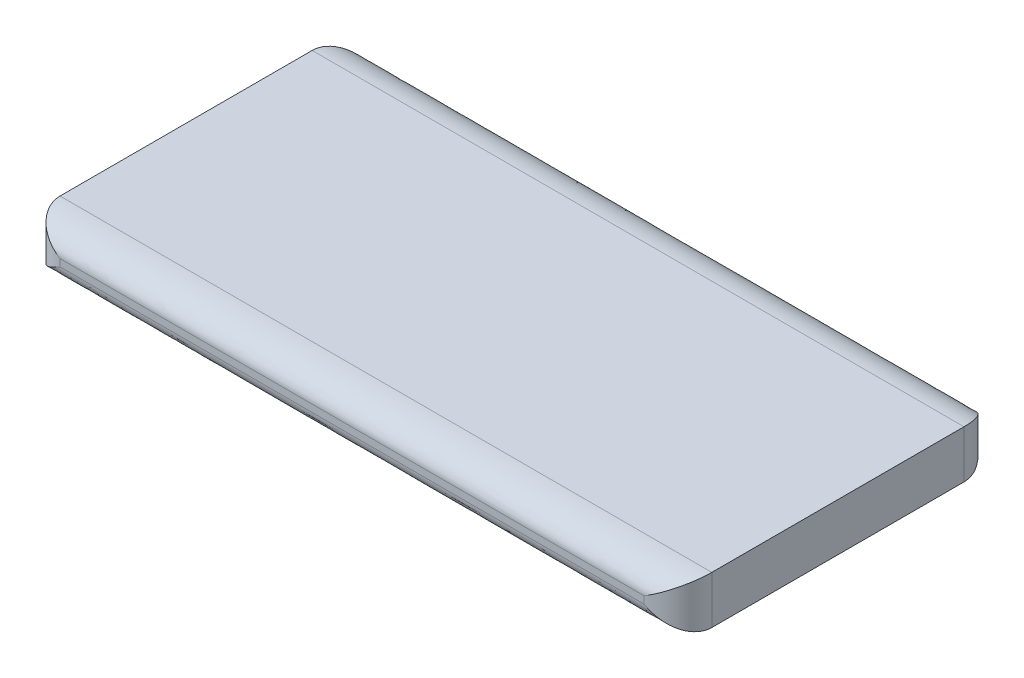
from build123d import *

# Parameters (mm, degrees)
BOSS_EXTRUDE1_DEPTH     = 10.6
FILLET4_SIZE            = 4.5
FILLET4_SIZE_2          = 7.5
FILLET3_SIZE            = 7.5
FILLET3_SIZE_2          = 4.5
FILLET5_START           = -47
FILLET5_DEPTH           = 146
FILLET6_START           = -47
FILLET6_DEPTH           = 146
CUT_EXTRUDE1_DEPTH      = 0.0001
CUT_EXTRUDE1_DEPTH_BACK = 47.330240243
USB_OUTPUT_W            = 13.1
USB_OUTPUT_H            = 5.5
CUT_EXTRUDE2_DEPTH      = 11.5
BOSS_EXTRUDE2_DEPTH     = 0.7
SKETCH6_R               = 0.5
CUT_EXTRUDE3_DEPTH      = 0.01
SKETCH8_R               = 0.5
CUT_EXTRUDE4_DEPTH      = 0.01
SKETCH9_R               = 0.5
CUT_EXTRUDE5_DEPTH      = 0.01
SKETCH11_R              = 0.5
CUT_EXTRUDE7_DEPTH      = 0.01


with BuildPart() as part:
    # Sketch1 → Boss-Extrude1 (new body)
    with BuildSketch(Plane(origin=(0, 0, 0), x_dir=(1, 0, 0), z_dir=(0, 1, 0))):
        with BuildLine():
            Line((-38.762171266, 45.621027844), (90.737828734, 45.621027844))
            ThreePointArc((90.737828734, 45.621027844), (96.041129593, 43.424328703), (98.237828734, 38.121027844))
            Line((98.237828734, 38.121027844), (98.237828734, -17.778972156))
            ThreePointArc((98.237828734, -17.778972156), (96.041129593, -23.082273015), (90.737828734, -25.278972156))
            Line((90.737828734, -25.278972156), (-38.762171266, -25.278972156))
            ThreePointArc((-38.762171266, -25.278972156), (-44.065472124, -23.082273015), (-46.262171266, -17.778972156))
            Line((-46.262171266, -17.778972156), (-46.262171266, 38.121027844))
            ThreePointArc((-46.262171266, 38.121027844), (-44.065472124, 43.424328703), (-38.762171266, 45.621027844))
        make_face()
    extrude(amount=BOSS_EXTRUDE1_DEPTH)

    # Fillet4
    # a fillet whose section is not a circle: 7.5, 4.5 mm, written as the material it takes off along each edge
    with BuildSketch(Plane(origin=(109.487828734, 0, 25.278972156), x_dir=(0, 1, 0), z_dir=(-1, 0, 0))) as fillet4_piece_1:
        with BuildLine():
            Bezier((FILLET4_SIZE, 0), (0, 0), (0, FILLET4_SIZE_2), weights=[1, 0.707106781, 1])
            Line((0, FILLET4_SIZE_2), (0, 0))
            Line((0, 0), (FILLET4_SIZE, 0))
        make_face()
    extrude(amount=167, mode=Mode.SUBTRACT)

    # Fillet3
    # a fillet whose section is not a circle: 7.5, 4.5 mm, written as the material it takes off along each edge
    with BuildSketch(Plane(origin=(109.487828734, 10.6, 25.278972156), x_dir=(0, 0, -1), z_dir=(-1, 0, 0))) as fillet3_piece_1:
        with BuildLine():
            Bezier((FILLET3_SIZE, 0), (0, 0), (0, FILLET3_SIZE_2), weights=[1, 0.707106781, 1])
            Line((0, FILLET3_SIZE_2), (0, 0))
            Line((0, 0), (FILLET3_SIZE, 0))
        make_face()
    extrude(amount=167, mode=Mode.SUBTRACT)

    # Fillet5: read off the stored shape, not the designer's step
    # Fillet5 outline → Fillet5 (cut)
    with BuildSketch(Plane.YZ.offset(FILLET5_START)):
        with BuildLine():
            Line((10.6, -45.621027844), (10.6, -38.121027844))
            add(Edge.make_bspline(
                [(10.6, -38.121027844), (10.6, -45.621027844), (6.1, -45.621027844)],
                knots=[0, 0, 0, 1, 1, 1], degree=2, weights=[1, 0.707106781, 1]))
            Line((6.1, -45.621027844), (10.6, -45.621027844))
        make_face()
    extrude(amount=FILLET5_DEPTH, mode=Mode.SUBTRACT)

    # Fillet6: read off the stored shape, not the designer's step
    # Fillet6 outline → Fillet6 (cut)
    with BuildSketch(Plane.YZ.offset(FILLET6_START)):
        with BuildLine():
            Line((0, -45.621027844), (4.5, -45.621027844))
            add(Edge.make_bspline(
                [(4.5, -45.621027844), (0, -45.621027844), (0, -38.121027844)],
                knots=[0, 0, 0, 1, 1, 1], degree=2, weights=[1, 0.707106781, 1]))
            Line((0, -38.121027844), (0, -45.621027844))
        make_face()
    extrude(amount=FILLET6_DEPTH, mode=Mode.SUBTRACT)

    # USB Output → Cut-Extrude1 (cut, two sides: drawn at the far end of the back side and taken through both)
    with BuildSketch(Plane(origin=(0, 0, -28.925486843), x_dir=(0, 0, -1), z_dir=(1, 0, 0)).offset(-CUT_EXTRUDE1_DEPTH_BACK)):
        with Locations((2.092448173, 5.540415323)):
            Rectangle(USB_OUTPUT_W, USB_OUTPUT_H)
    extrude(amount=CUT_EXTRUDE1_DEPTH + CUT_EXTRUDE1_DEPTH_BACK, mode=Mode.SUBTRACT)

    # USB Charger → Cut-Extrude2 (cut)
    with BuildSketch(Plane.ZY.offset(46.262171266)):
        with BuildLine():
            Line((-18.574888724, 6.232091877), (-13.974888724, 6.232091877))
            ThreePointArc((-13.974888724, 6.232091877), (-12.914228552, 5.792752049), (-12.474888724, 4.732091877))
            Line((-12.474888724, 4.732091877), (-12.474888724, 4.132091877))
            Line((-12.474888724, 4.132091877), (-20.074888724, 4.132091877))
            Line((-20.074888724, 4.132091877), (-20.074888724, 4.732091877))
            ThreePointArc((-20.074888724, 4.732091877), (-19.635548896, 5.792752049), (-18.574888724, 6.232091877))
        make_face()
    extrude(amount=-CUT_EXTRUDE2_DEPTH, mode=Mode.SUBTRACT)

    # Sketch4 → Boss-Extrude2 (add)
    with BuildSketch(Plane.ZY.offset(46.262171266)):
        with BuildLine():
            Line((18.15777008, 6.213830992), (11.65777008, 6.213830992))
            ThreePointArc((11.65777008, 6.213830992), (11.021373976, 5.950227095), (10.75777008, 5.313830992))
            Line((10.75777008, 5.313830992), (10.75777008, 5.113830992))
            ThreePointArc((10.75777008, 5.113830992), (11.021373976, 4.477434889), (11.65777008, 4.213830992))
            Line((11.65777008, 4.213830992), (18.15777008, 4.213830992))
            ThreePointArc((18.15777008, 4.213830992), (18.794166183, 4.477434889), (19.05777008, 5.113830992))
            Line((19.05777008, 5.113830992), (19.05777008, 5.313830992))
            ThreePointArc((19.05777008, 5.313830992), (18.794166183, 5.950227095), (18.15777008, 6.213830992))
        make_face()
    extrude(amount=BOSS_EXTRUDE2_DEPTH)

    # Sketch6 → Cut-Extrude3 (cut)
    with BuildSketch(Plane(origin=(-46.262171266, 0, -7.484845673), x_dir=(0, 0, 1), z_dir=(-1, 0, 0))):
        with Locations((8.355271575, 5.224549503)):
            Circle(SKETCH6_R)
    extrude(amount=-CUT_EXTRUDE3_DEPTH, mode=Mode.SUBTRACT)

    # Sketch8 → Cut-Extrude4 (cut)
    with BuildSketch(Plane.ZY.offset(46.262171266)):
        with Locations((8.346381579, 5.258350764)):
            Circle(SKETCH8_R)
    extrude(amount=-CUT_EXTRUDE4_DEPTH, mode=Mode.SUBTRACT)

    # Sketch9 → Cut-Extrude5 (cut)
    with BuildSketch(Plane(origin=(-46.262171266, 1.999999249, 4.454543781), x_dir=(0, 0, 1), z_dir=(-1, 0, 0))):
        with Locations((1.386907241, 3.201460838)):
            Circle(SKETCH9_R)
    extrude(amount=-CUT_EXTRUDE5_DEPTH, mode=Mode.SUBTRACT)

    # Sketch11 → Cut-Extrude7 (cut)
    with BuildSketch(Plane(origin=(-46.262171266, 2.666665665, -5.363634349), x_dir=(0, 0, 1), z_dir=(-1, 0, 0))):
        with Locations((8.659631782, 2.56509744)):
            Circle(SKETCH11_R)
    extrude(amount=-CUT_EXTRUDE7_DEPTH, mode=Mode.SUBTRACT)


solid = part.part
